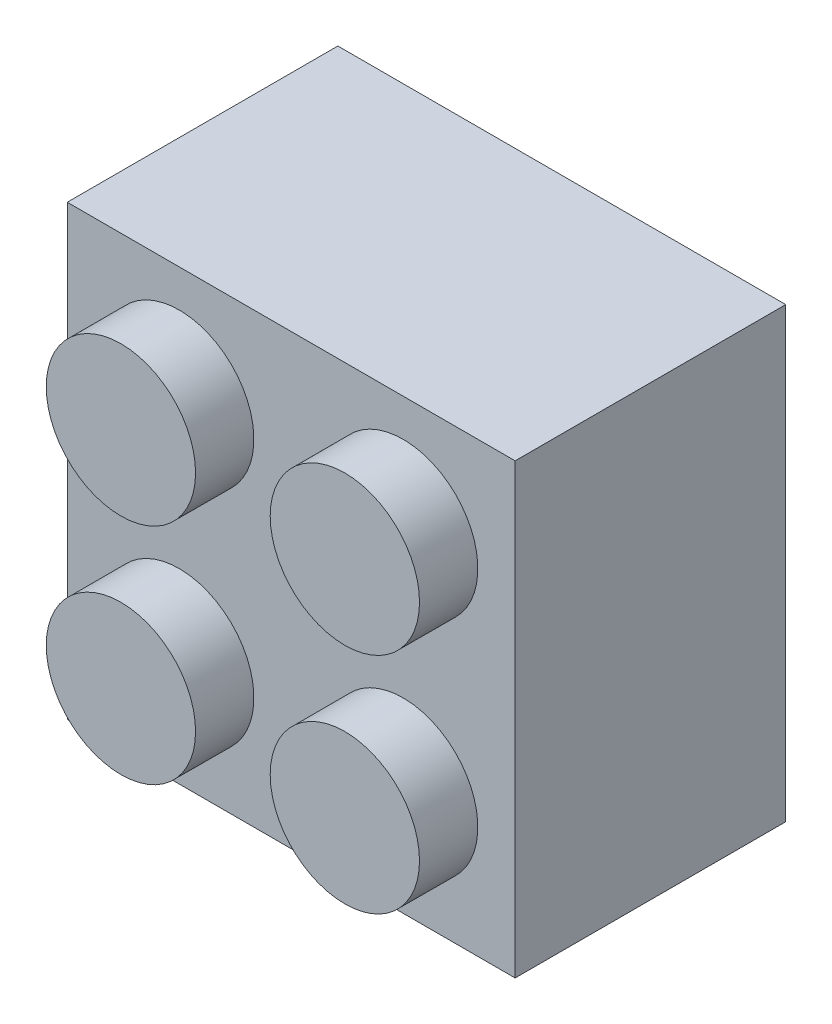
from build123d import *

# Parameters (mm, degrees)
ESQUISSE1_W        = 96
ESQUISSE1_H        = 96
ESQUISSE1_W_2      = 80
ESQUISSE1_H_2      = 80
BOSS_EXTRU_1_DEPTH = 48
ESQUISSE2_W        = 96
ESQUISSE2_H        = 96
BOSS_EXTRU_3_DEPTH = 10
ESQUISSE3_R        = 16
BOSS_EXTRU_4_DEPTH = 12.5
ESQUISSE4_R        = 18.5
ESQUISSE4_R_2      = 11.5
BOSS_EXTRU_5_DEPTH = 48
CHANFREIN1_SIZE2   = 48
CHANFREIN1_SIZE    = 4.199455849


with BuildPart() as part:
    # Esquisse1 → Boss.-Extru.1 (new body)
    with BuildSketch(Plane.XY):
        Rectangle(ESQUISSE1_W, ESQUISSE1_H)
        Rectangle(ESQUISSE1_W_2, ESQUISSE1_H_2, mode=Mode.SUBTRACT)
    extrude(amount=BOSS_EXTRU_1_DEPTH)

    # Esquisse2 → Boss.-Extru.3 (add)
    with BuildSketch(Plane.XY.offset(48)):
        Rectangle(ESQUISSE2_W, ESQUISSE2_H)
    extrude(amount=BOSS_EXTRU_3_DEPTH)

    # Esquisse3 → Boss.-Extru.4 (add)
    with BuildSketch(Plane.XY.offset(58)):
        with Locations(Location((-24, 24, 0), (0, 0, 180))):
            Circle(ESQUISSE3_R)
        with Locations(Location((24, 24, 0), (0, 0, 180))):
            Circle(ESQUISSE3_R)
        with Locations(Location((24, -24, 0), (0, 0, 180))):
            Circle(ESQUISSE3_R)
        with Locations(Location((-24, -24, 0), (0, 0, 180))):
            Circle(ESQUISSE3_R)
    extrude(amount=BOSS_EXTRU_4_DEPTH)

    # Esquisse4 → Boss.-Extru.5 (add)
    with BuildSketch(Plane(origin=(0, 0, 0), x_dir=(-1, 0, 0), z_dir=(0, 0, -1))):
        Circle(ESQUISSE4_R)
        Circle(ESQUISSE4_R_2, mode=Mode.SUBTRACT)
    extrude(amount=-BOSS_EXTRU_5_DEPTH)

    # Chanfrein1
    chanfrein1_edges = [part.edges().sort_by_distance(p)[0] for p in [
        (18.5, 0, 48),
    ]]
    chanfrein1_side = [part.faces().sort_by_distance(p)[0] for p in [
        (18.583989117, 0, 48),
    ]]
    chamfer(chanfrein1_edges, length=CHANFREIN1_SIZE - 0.0001, length2=CHANFREIN1_SIZE2 - 0.0001, reference=chanfrein1_side[0])  # a hair under: the kernel refuses the full size


solid = part.part
